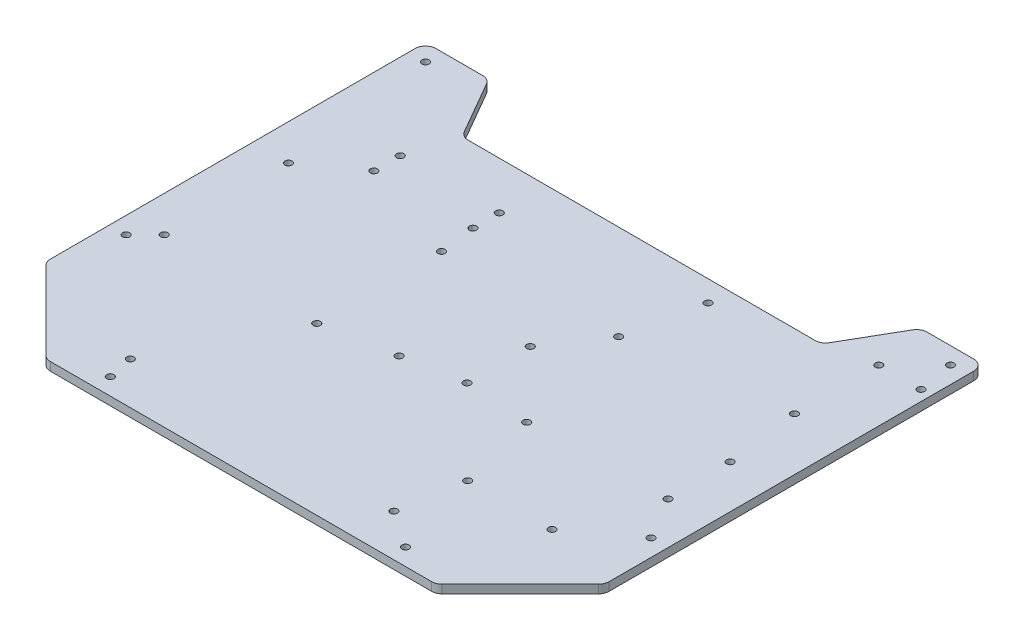
from build123d import *

# Parameters (mm, degrees)
MAIN_EXTRUSION_DEPTH    = 4
CONG_1_R                = 5
ESQUISSE1_R             = 1
ENL_V_MAT_EXTRU_1_DEPTH = 257.850637531
D_GAGEMENT_M31_D        = 3.4
ESQUISSE4_R             = 1
ENL_V_MAT_EXTRU_2_DEPTH = 257.850637531
D_GAGEMENT_M32_D        = 3.4


with BuildPart() as part:
    # Main scetch → Main extrusion (new body)
    with BuildSketch(Plane(origin=(0, 0, 0), x_dir=(1, 0, 0), z_dir=(0, 1, 0))):
        Polygon((-92.5, 0), (92.5, 0), (132.5, 40), (132.5, 220), (102.5, 220), (85.179491924, 190), (-85.179491924, 190), (-102.5, 220), (-132.5, 220), (-132.5, 40), align=None)
    extrude(amount=MAIN_EXTRUSION_DEPTH)

    # Congé1
    cong_1_edges = [part.edges().sort_by_distance(p)[0] for p in [
        (-132.5, 2, -40),
        (-92.5, 2, 0),
        (92.5, 2, 0),
        (132.5, 2, -40),
        (132.5, 2, -220),
        (102.5, 2, -220),
        (85.179491924, 2, -190),
        (-85.179491924, 2, -190),
        (-102.5, 2, -220),
        (-132.5, 2, -220),
    ]]
    fillet(cong_1_edges, radius=CONG_1_R)

    # Esquisse1 → Enlèv. mat.-Extru.1 (cut, through all)
    with BuildSketch(Plane(origin=(0, 4, 0), x_dir=(1, 0, 0), z_dir=(0, 1, 0))):
        with Locations((70, 8)):
            Circle(ESQUISSE1_R)
        with Locations((124.5, 70)):
            Circle(ESQUISSE1_R)
        with Locations((124.5, 212)):
            Circle(ESQUISSE1_R)
        with Locations((-124.5, 212)):
            Circle(ESQUISSE1_R)
        with Locations((-124.5, 70)):
            Circle(ESQUISSE1_R)
        with Locations((-70, 8)):
            Circle(ESQUISSE1_R)
    extrude(amount=-ENL_V_MAT_EXTRU_1_DEPTH, mode=Mode.SUBTRACT)

    # Dégagement M31 (through all)
    with Locations(Plane(origin=(0, 4, 0), x_dir=(1, 0, 0), z_dir=(0, 1, 0))):
        with Locations((-124.5, 212), (-124.5, 70), (-70, 8), (70, 8), (124.5, 70), (124.5, 212)):
            Hole(D_GAGEMENT_M31_D / 2)

    # Esquisse4 → Enlèv. mat.-Extru.2 (cut, through all)
    with BuildSketch(Plane(origin=(0, 4, 0), x_dir=(1, 0, 0), z_dir=(0, 1, 0))):
        with Locations((41.5, 180)):
            Circle(ESQUISSE4_R)
        with Locations((34.12, 145)):
            Circle(ESQUISSE4_R)
        with Locations((107.5, 155)):
            Circle(ESQUISSE4_R)
        with Locations((127.5, 195)):
            Circle(ESQUISSE4_R)
        with Locations((112, 120)):
            Circle(ESQUISSE4_R)
        with Locations((112.5, 90)):
            Circle(ESQUISSE4_R)
        with Locations((17.2, 120)):
            Circle(ESQUISSE4_R)
        with Locations((17.2, 90)):
            Circle(ESQUISSE4_R)
        with Locations((47.5, 88)):
            Circle(ESQUISSE4_R)
        with Locations((57.5, 50)):
            Circle(ESQUISSE4_R)
        with Locations((97.5, 50)):
            Circle(ESQUISSE4_R)
        with Locations((52.5, 20)):
            Circle(ESQUISSE4_R)
        with Locations((-10, 85)):
            Circle(ESQUISSE4_R)
        with Locations((-72.5, 20)):
            Circle(ESQUISSE4_R)
        with Locations((107.5, 195)):
            Circle(ESQUISSE4_R)
        with Locations((-115.5, 138)):
            Circle(ESQUISSE4_R)
        with Locations((-42.86, 138)):
            Circle(ESQUISSE4_R)
        with Locations((-115.5, 79.07)):
            Circle(ESQUISSE4_R)
        with Locations((-42.890430383, 78.82)):
            Circle(ESQUISSE4_R)
        with Locations((-92, 167.5)):
            Circle(ESQUISSE4_R)
        with Locations((-45, 167.5)):
            Circle(ESQUISSE4_R)
        with Locations((-92, 155)):
            Circle(ESQUISSE4_R)
        with Locations((-45, 155)):
            Circle(ESQUISSE4_R)
    extrude(amount=-ENL_V_MAT_EXTRU_2_DEPTH, mode=Mode.SUBTRACT)

    # Dégagement M32 (through all)
    with Locations(Plane(origin=(0, 4, 0), x_dir=(1, 0, 0), z_dir=(0, 1, 0))):
        with Locations((17.2, 120), (34.12, 145), (41.5, 180), (107.5, 155), (127.5, 195), (112, 120), (112.5, 90), (47.5, 88), (17.2, 90), (57.5, 50), (97.5, 50), (-10, 85), (-72.5, 20), (52.5, 20), (107.5, 195), (-115.5, 138), (-42.86, 138), (-115.5, 79.07), (-42.890430383, 78.82), (-92, 167.5), (-92, 155), (-45, 155), (-45, 167.5)):
            Hole(D_GAGEMENT_M32_D / 2)


solid = part.part
